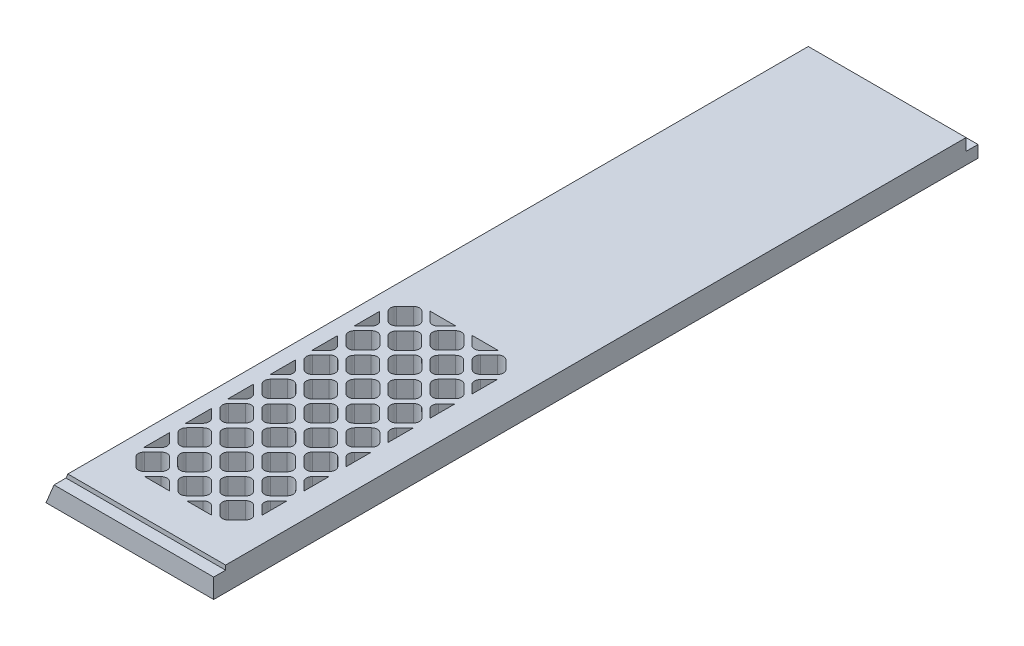
from build123d import *

# Parameters (mm, degrees)
BOSS_EXTRUDE1_DEPTH = 406.4
SKETCH2_W           = 89.154
SKETCH2_H           = 6.35
CUT_EXTRUDE1_DEPTH  = 2.3622
CUT_EXTRUDE2_DEPTH  = 417.257955739
SKETCH4_W           = 98.256448513
SKETCH4_H           = 6.35
CUT_EXTRUDE3_DEPTH  = 6.35


with BuildPart() as part:
    # Sketch1 → Boss-Extrude1 (new body)
    with BuildSketch(Plane.XY):
        Polygon((0, 0), (5.260512242, 12.7), (89.154, 12.7), (89.154, 0), align=None)
    extrude(amount=BOSS_EXTRUDE1_DEPTH)

    # Sketch2 → Cut-Extrude1 (cut)
    with BuildSketch(Plane.XZ.offset(-12.7)):
        with Locations((44.577, 403.225)):
            Rectangle(SKETCH2_W, SKETCH2_H)
    extrude(amount=CUT_EXTRUDE1_DEPTH, mode=Mode.SUBTRACT)

    # Sketch3 → Cut-Extrude2 (cut, through all)
    with BuildSketch(Plane.XZ):
        with BuildLine():
            Line((13.244743879, 255.975205334), (13.244743879, 242.242295027))
            ThreePointArc((13.244743879, 242.242295027), (13.315448739, 242.306875127), (13.384173908, 242.37355809))
            Line((13.384173908, 242.37355809), (17.874301968, 246.863686151))
            ThreePointArc((17.874301968, 246.863686151), (18.804237938, 249.108750181), (17.874301968, 251.353814211))
            Line((17.874301968, 251.353814211), (13.384173908, 255.843942271))
            ThreePointArc((13.384173908, 255.843942271), (13.315448739, 255.910625234), (13.244743879, 255.975205334))
        make_face()
        with BuildLine():
            ThreePointArc((26.755917787, 229.001814211), (26.645338589, 228.885498635), (26.54077831, 228.763743879))
            Line((26.54077831, 228.763743879), (40.441441445, 228.763743879))
            ThreePointArc((40.441441445, 228.763743879), (40.336881166, 228.885498635), (40.226301968, 229.001814211))
            Line((40.226301968, 229.001814211), (35.736173908, 233.491942271))
            ThreePointArc((35.736173908, 233.491942271), (33.491109878, 234.421878241), (31.246045847, 233.491942271))
            Line((31.246045847, 233.491942271), (26.755917787, 229.001814211))
        make_face()
        with BuildLine():
            Line((13.244743879, 278.327205334), (13.244743879, 264.594295027))
            ThreePointArc((13.244743879, 264.594295027), (13.315448739, 264.658875127), (13.384173908, 264.72555809))
            Line((13.384173908, 264.72555809), (17.874301968, 269.215686151))
            ThreePointArc((17.874301968, 269.215686151), (18.804237938, 271.460750181), (17.874301968, 273.705814211))
            Line((17.874301968, 273.705814211), (13.384173908, 278.195942271))
            ThreePointArc((13.384173908, 278.195942271), (13.315448739, 278.262625234), (13.244743879, 278.327205334))
        make_face()
        with BuildLine():
            ThreePointArc((49.107917787, 229.001814211), (48.997338588, 228.885498635), (48.89277831, 228.763743879))
            Line((48.89277831, 228.763743879), (62.793441445, 228.763743879))
            ThreePointArc((62.793441445, 228.763743879), (62.688881166, 228.885498635), (62.578301968, 229.001814211))
            Line((62.578301968, 229.001814211), (58.088173908, 233.491942271))
            ThreePointArc((58.088173908, 233.491942271), (55.843109877, 234.421878241), (53.598045847, 233.491942271))
            Line((53.598045847, 233.491942271), (49.107917787, 229.001814211))
        make_face()
        with BuildLine():
            Line((13.244743879, 300.679205334), (13.244743879, 286.946295027))
            ThreePointArc((13.244743879, 286.946295027), (13.315448739, 287.010875127), (13.384173908, 287.07755809))
            Line((13.384173908, 287.07755809), (17.874301968, 291.56768615))
            ThreePointArc((17.874301968, 291.56768615), (18.804237938, 293.812750181), (17.874301968, 296.057814211))
            Line((17.874301968, 296.057814211), (13.384173908, 300.547942271))
            ThreePointArc((13.384173908, 300.547942271), (13.315448739, 300.614625234), (13.244743879, 300.679205334))
        make_face()
        with BuildLine():
            Line((13.244743879, 323.031205334), (13.244743879, 309.298295027))
            ThreePointArc((13.244743879, 309.298295027), (13.315448739, 309.362875127), (13.384173908, 309.42955809))
            Line((13.384173908, 309.42955809), (17.874301968, 313.91968615))
            ThreePointArc((17.874301968, 313.91968615), (18.804237938, 316.16475018), (17.874301968, 318.409814211))
            Line((17.874301968, 318.409814211), (13.384173908, 322.899942271))
            ThreePointArc((13.384173908, 322.899942271), (13.315448739, 322.966625234), (13.244743879, 323.031205334))
        make_face()
        with BuildLine():
            Line((71.459917787, 246.86368615), (75.909256121, 242.414347816))
            Line((75.909256121, 242.414347816), (75.909256121, 255.803152545))
            Line((75.909256121, 255.803152545), (71.459917787, 251.353814211))
            ThreePointArc((71.459917787, 251.353814211), (70.529981817, 249.108750181), (71.459917787, 246.86368615))
        make_face()
        with BuildLine():
            Line((13.244743879, 345.383205334), (13.244743879, 331.650295027))
            ThreePointArc((13.244743879, 331.650295027), (13.315448739, 331.714875127), (13.384173908, 331.78155809))
            Line((13.384173908, 331.78155809), (17.874301968, 336.27168615))
            ThreePointArc((17.874301968, 336.27168615), (18.804237938, 338.51675018), (17.874301968, 340.761814211))
            Line((17.874301968, 340.761814211), (13.384173908, 345.251942271))
            ThreePointArc((13.384173908, 345.251942271), (13.315448739, 345.318625234), (13.244743879, 345.383205334))
        make_face()
        with BuildLine():
            Line((71.459917786, 269.21568615), (75.909256121, 264.766347816))
            Line((75.909256121, 264.766347816), (75.909256121, 278.155152546))
            Line((75.909256121, 278.155152546), (71.459917786, 273.705814211))
            ThreePointArc((71.459917786, 273.705814211), (70.529981817, 271.460750181), (71.459917786, 269.21568615))
        make_face()
        with BuildLine():
            Line((13.244743879, 367.735205334), (13.244743879, 354.002295027))
            ThreePointArc((13.244743879, 354.002295027), (13.315448739, 354.066875126), (13.384173908, 354.13355809))
            Line((13.384173908, 354.13355809), (17.874301968, 358.62368615))
            ThreePointArc((17.874301968, 358.62368615), (18.804237938, 360.86875018), (17.874301968, 363.113814211))
            Line((17.874301968, 363.113814211), (13.384173908, 367.603942271))
            ThreePointArc((13.384173908, 367.603942271), (13.315448739, 367.670625234), (13.244743879, 367.735205334))
        make_face()
        with BuildLine():
            Line((71.459917786, 291.56768615), (75.909256121, 287.118347816))
            Line((75.909256121, 287.118347816), (75.909256121, 300.507152545))
            Line((75.909256121, 300.507152545), (71.459917786, 296.057814211))
            ThreePointArc((71.459917786, 296.057814211), (70.529981817, 293.812750181), (71.459917786, 291.56768615))
        make_face()
        with BuildLine():
            Line((71.459917786, 313.91968615), (75.909256121, 309.470347816))
            Line((75.909256121, 309.470347816), (75.909256121, 322.859152545))
            Line((75.909256121, 322.859152545), (71.459917786, 318.409814211))
            ThreePointArc((71.459917786, 318.409814211), (70.529981817, 316.164750181), (71.459917786, 313.91968615))
        make_face()
        with BuildLine():
            Line((40.086871939, 380.836256121), (26.895347816, 380.836256121))
            Line((26.895347816, 380.836256121), (31.246045847, 376.485558089))
            ThreePointArc((31.246045847, 376.485558089), (33.491109877, 375.55562212), (35.736173908, 376.485558089))
            Line((35.736173908, 376.485558089), (40.086871939, 380.836256121))
        make_face()
        with BuildLine():
            Line((71.459917787, 336.27168615), (75.909256121, 331.822347816))
            Line((75.909256121, 331.822347816), (75.909256121, 345.211152545))
            Line((75.909256121, 345.211152545), (71.459917787, 340.761814211))
            ThreePointArc((71.459917787, 340.761814211), (70.529981817, 338.51675018), (71.459917787, 336.27168615))
        make_face()
        with BuildLine():
            Line((62.438871939, 380.836256121), (49.247347815, 380.836256121))
            Line((49.247347815, 380.836256121), (53.598045847, 376.485558089))
            ThreePointArc((53.598045847, 376.485558089), (55.843109877, 375.55562212), (58.088173908, 376.485558089))
            Line((58.088173908, 376.485558089), (62.438871939, 380.836256121))
        make_face()
        with BuildLine():
            Line((71.459917787, 358.62368615), (75.909256121, 354.174347816))
            Line((75.909256121, 354.174347816), (75.909256121, 367.563152545))
            Line((75.909256121, 367.563152545), (71.459917787, 363.113814211))
            ThreePointArc((71.459917787, 363.113814211), (70.529981817, 360.86875018), (71.459917787, 358.62368615))
        make_face()
        with BuildLine():
            Line((53.598045847, 255.843942272), (49.107917787, 251.353814211))
            ThreePointArc((49.107917787, 251.353814211), (48.177981817, 249.108750181), (49.107917787, 246.863686151))
            Line((49.107917787, 246.863686151), (53.598045847, 242.37355809))
            ThreePointArc((53.598045847, 242.37355809), (55.843109877, 241.44362212), (58.088173908, 242.37355809))
            Line((58.088173908, 242.37355809), (62.578301968, 246.863686151))
            ThreePointArc((62.578301968, 246.863686151), (63.508237938, 249.108750181), (62.578301968, 251.353814211))
            Line((62.578301968, 251.353814211), (58.088173908, 255.843942272))
            ThreePointArc((58.088173908, 255.843942272), (55.843109877, 256.773878241), (53.598045847, 255.843942272))
        make_face()
        with BuildLine():
            Line((31.246045847, 255.843942272), (26.755917787, 251.353814211))
            ThreePointArc((26.755917787, 251.353814211), (25.825981817, 249.108750181), (26.755917787, 246.863686151))
            Line((26.755917787, 246.863686151), (31.246045847, 242.37355809))
            ThreePointArc((31.246045847, 242.37355809), (33.491109877, 241.44362212), (35.736173908, 242.37355809))
            Line((35.736173908, 242.37355809), (40.226301968, 246.863686151))
            ThreePointArc((40.226301968, 246.863686151), (41.156237938, 249.108750181), (40.226301968, 251.353814211))
            Line((40.226301968, 251.353814211), (35.736173908, 255.843942272))
            ThreePointArc((35.736173908, 255.843942272), (33.491109877, 256.773878241), (31.246045847, 255.843942272))
        make_face()
        with BuildLine():
            Line((53.598045847, 278.195942272), (49.107917787, 273.705814211))
            ThreePointArc((49.107917787, 273.705814211), (48.177981817, 271.460750181), (49.107917787, 269.215686151))
            Line((49.107917787, 269.215686151), (53.598045847, 264.72555809))
            ThreePointArc((53.598045847, 264.72555809), (55.843109877, 263.79562212), (58.088173908, 264.72555809))
            Line((58.088173908, 264.72555809), (62.578301968, 269.215686151))
            ThreePointArc((62.578301968, 269.215686151), (63.508237938, 271.460750181), (62.578301968, 273.705814211))
            Line((62.578301968, 273.705814211), (58.088173908, 278.195942272))
            ThreePointArc((58.088173908, 278.195942272), (55.843109877, 279.125878241), (53.598045847, 278.195942272))
        make_face()
        with BuildLine():
            Line((31.246045847, 278.195942272), (26.755917787, 273.705814211))
            ThreePointArc((26.755917787, 273.705814211), (25.825981817, 271.460750181), (26.755917787, 269.215686151))
            Line((26.755917787, 269.215686151), (31.246045847, 264.72555809))
            ThreePointArc((31.246045847, 264.72555809), (33.491109877, 263.79562212), (35.736173908, 264.72555809))
            Line((35.736173908, 264.72555809), (40.226301968, 269.215686151))
            ThreePointArc((40.226301968, 269.215686151), (41.156237938, 271.460750181), (40.226301968, 273.705814211))
            Line((40.226301968, 273.705814211), (35.736173908, 278.195942272))
            ThreePointArc((35.736173908, 278.195942272), (33.491109877, 279.125878241), (31.246045847, 278.195942272))
        make_face()
        with BuildLine():
            Line((53.598045847, 300.547942271), (49.107917787, 296.057814211))
            ThreePointArc((49.107917787, 296.057814211), (48.177981817, 293.812750181), (49.107917787, 291.56768615))
            Line((49.107917787, 291.56768615), (53.598045847, 287.07755809))
            ThreePointArc((53.598045847, 287.07755809), (55.843109877, 286.14762212), (58.088173908, 287.07755809))
            Line((58.088173908, 287.07755809), (62.578301968, 291.56768615))
            ThreePointArc((62.578301968, 291.56768615), (63.508237938, 293.812750181), (62.578301968, 296.057814211))
            Line((62.578301968, 296.057814211), (58.088173908, 300.547942271))
            ThreePointArc((58.088173908, 300.547942271), (55.843109877, 301.477878241), (53.598045847, 300.547942271))
        make_face()
        with BuildLine():
            Line((31.246045847, 300.547942271), (26.755917787, 296.057814211))
            ThreePointArc((26.755917787, 296.057814211), (25.825981817, 293.812750181), (26.755917787, 291.56768615))
            Line((26.755917787, 291.56768615), (31.246045847, 287.07755809))
            ThreePointArc((31.246045847, 287.07755809), (33.491109877, 286.14762212), (35.736173908, 287.07755809))
            Line((35.736173908, 287.07755809), (40.226301968, 291.56768615))
            ThreePointArc((40.226301968, 291.56768615), (41.156237938, 293.812750181), (40.226301968, 296.057814211))
            Line((40.226301968, 296.057814211), (35.736173908, 300.547942271))
            ThreePointArc((35.736173908, 300.547942271), (33.491109877, 301.477878241), (31.246045847, 300.547942271))
        make_face()
        with BuildLine():
            Line((53.598045847, 322.899942271), (49.107917787, 318.409814211))
            ThreePointArc((49.107917787, 318.409814211), (48.177981817, 316.164750181), (49.107917787, 313.91968615))
            Line((49.107917787, 313.91968615), (53.598045847, 309.42955809))
            ThreePointArc((53.598045847, 309.42955809), (55.843109877, 308.49962212), (58.088173908, 309.42955809))
            Line((58.088173908, 309.42955809), (62.578301968, 313.91968615))
            ThreePointArc((62.578301968, 313.91968615), (63.508237938, 316.164750181), (62.578301968, 318.409814211))
            Line((62.578301968, 318.409814211), (58.088173908, 322.899942271))
            ThreePointArc((58.088173908, 322.899942271), (55.843109877, 323.829878241), (53.598045847, 322.899942271))
        make_face()
        with BuildLine():
            Line((31.246045847, 322.899942271), (26.755917787, 318.409814211))
            ThreePointArc((26.755917787, 318.409814211), (25.825981817, 316.164750181), (26.755917787, 313.91968615))
            Line((26.755917787, 313.91968615), (31.246045847, 309.42955809))
            ThreePointArc((31.246045847, 309.42955809), (33.491109877, 308.49962212), (35.736173908, 309.42955809))
            Line((35.736173908, 309.42955809), (40.226301968, 313.91968615))
            ThreePointArc((40.226301968, 313.91968615), (41.156237938, 316.164750181), (40.226301968, 318.409814211))
            Line((40.226301968, 318.409814211), (35.736173908, 322.899942271))
            ThreePointArc((35.736173908, 322.899942271), (33.491109877, 323.829878241), (31.246045847, 322.899942271))
        make_face()
        with BuildLine():
            Line((53.598045847, 345.251942271), (49.107917787, 340.761814211))
            ThreePointArc((49.107917787, 340.761814211), (48.177981817, 338.51675018), (49.107917787, 336.27168615))
            Line((49.107917787, 336.27168615), (53.598045847, 331.78155809))
            ThreePointArc((53.598045847, 331.78155809), (55.843109877, 330.85162212), (58.088173908, 331.78155809))
            Line((58.088173908, 331.78155809), (62.578301968, 336.27168615))
            ThreePointArc((62.578301968, 336.27168615), (63.508237938, 338.51675018), (62.578301968, 340.761814211))
            Line((62.578301968, 340.761814211), (58.088173908, 345.251942271))
            ThreePointArc((58.088173908, 345.251942271), (55.843109877, 346.181878241), (53.598045847, 345.251942271))
        make_face()
        with BuildLine():
            Line((31.246045847, 345.251942271), (26.755917787, 340.761814211))
            ThreePointArc((26.755917787, 340.761814211), (25.825981817, 338.51675018), (26.755917787, 336.27168615))
            Line((26.755917787, 336.27168615), (31.246045847, 331.78155809))
            ThreePointArc((31.246045847, 331.78155809), (33.491109877, 330.85162212), (35.736173908, 331.78155809))
            Line((35.736173908, 331.78155809), (40.226301968, 336.27168615))
            ThreePointArc((40.226301968, 336.27168615), (41.156237938, 338.51675018), (40.226301968, 340.761814211))
            Line((40.226301968, 340.761814211), (35.736173908, 345.251942271))
            ThreePointArc((35.736173908, 345.251942271), (33.491109877, 346.181878241), (31.246045847, 345.251942271))
        make_face()
        with BuildLine():
            Line((53.598045847, 367.603942271), (49.107917787, 363.113814211))
            ThreePointArc((49.107917787, 363.113814211), (48.177981817, 360.86875018), (49.107917787, 358.62368615))
            Line((49.107917787, 358.62368615), (53.598045847, 354.13355809))
            ThreePointArc((53.598045847, 354.13355809), (55.843109877, 353.20362212), (58.088173908, 354.13355809))
            Line((58.088173908, 354.13355809), (62.578301968, 358.62368615))
            ThreePointArc((62.578301968, 358.62368615), (63.508237938, 360.86875018), (62.578301968, 363.113814211))
            Line((62.578301968, 363.113814211), (58.088173908, 367.603942271))
            ThreePointArc((58.088173908, 367.603942271), (55.843109877, 368.533878241), (53.598045847, 367.603942271))
        make_face()
        with BuildLine():
            Line((31.246045847, 367.603942271), (26.755917787, 363.113814211))
            ThreePointArc((26.755917787, 363.113814211), (25.825981817, 360.86875018), (26.755917787, 358.62368615))
            Line((26.755917787, 358.62368615), (31.246045847, 354.13355809))
            ThreePointArc((31.246045847, 354.13355809), (33.491109877, 353.20362212), (35.736173908, 354.13355809))
            Line((35.736173908, 354.13355809), (40.226301968, 358.62368615))
            ThreePointArc((40.226301968, 358.62368615), (41.156237938, 360.86875018), (40.226301968, 363.113814211))
            Line((40.226301968, 363.113814211), (35.736173908, 367.603942271))
            ThreePointArc((35.736173908, 367.603942271), (33.491109877, 368.533878241), (31.246045847, 367.603942271))
        make_face()
        with BuildLine():
            Line((69.17406403, 231.008807909), (73.664192091, 235.49893597))
            ThreePointArc((73.664192091, 235.49893597), (74.594128061, 237.744), (73.664192091, 239.98906403))
            Line((73.664192091, 239.98906403), (69.17406403, 244.479192091))
            ThreePointArc((69.17406403, 244.479192091), (66.929, 245.409128061), (64.68393597, 244.479192091))
            Line((64.68393597, 244.479192091), (60.193807909, 239.98906403))
            ThreePointArc((60.193807909, 239.98906403), (59.263871939, 237.744), (60.193807909, 235.49893597))
            Line((60.193807909, 235.49893597), (64.68393597, 231.008807909))
            ThreePointArc((64.68393597, 231.008807909), (66.929, 230.078871939), (69.17406403, 231.008807909))
        make_face()
        with BuildLine():
            Line((46.82206403, 231.008807909), (51.312192091, 235.49893597))
            ThreePointArc((51.312192091, 235.49893597), (52.242128061, 237.744), (51.312192091, 239.98906403))
            Line((51.312192091, 239.98906403), (46.82206403, 244.479192091))
            ThreePointArc((46.82206403, 244.479192091), (44.577, 245.409128061), (42.33193597, 244.479192091))
            Line((42.33193597, 244.479192091), (37.841807909, 239.98906403))
            ThreePointArc((37.841807909, 239.98906403), (36.911871939, 237.744), (37.841807909, 235.49893597))
            Line((37.841807909, 235.49893597), (42.33193597, 231.008807909))
            ThreePointArc((42.33193597, 231.008807909), (44.577, 230.078871939), (46.82206403, 231.008807909))
        make_face()
        with BuildLine():
            Line((24.47006403, 231.008807909), (28.960192091, 235.49893597))
            ThreePointArc((28.960192091, 235.49893597), (29.890128061, 237.744), (28.960192091, 239.98906403))
            Line((28.960192091, 239.98906403), (24.47006403, 244.479192091))
            ThreePointArc((24.47006403, 244.479192091), (22.225, 245.409128061), (19.97993597, 244.479192091))
            Line((19.97993597, 244.479192091), (15.489807909, 239.98906403))
            ThreePointArc((15.489807909, 239.98906403), (14.559871939, 237.744), (15.489807909, 235.49893597))
            Line((15.489807909, 235.49893597), (19.97993597, 231.008807909))
            ThreePointArc((19.97993597, 231.008807909), (22.225, 230.078871939), (24.47006403, 231.008807909))
        make_face()
        with BuildLine():
            Line((69.17406403, 253.360807909), (73.664192091, 257.85093597))
            ThreePointArc((73.664192091, 257.85093597), (74.594128061, 260.096), (73.664192091, 262.34106403))
            Line((73.664192091, 262.34106403), (69.17406403, 266.831192091))
            ThreePointArc((69.17406403, 266.831192091), (66.929, 267.761128061), (64.68393597, 266.831192091))
            Line((64.68393597, 266.831192091), (60.193807909, 262.34106403))
            ThreePointArc((60.193807909, 262.34106403), (59.263871939, 260.096), (60.193807909, 257.85093597))
            Line((60.193807909, 257.85093597), (64.68393597, 253.360807909))
            ThreePointArc((64.68393597, 253.360807909), (66.929, 252.430871939), (69.17406403, 253.360807909))
        make_face()
        with BuildLine():
            Line((46.82206403, 253.360807909), (51.312192091, 257.85093597))
            ThreePointArc((51.312192091, 257.85093597), (52.242128061, 260.096), (51.312192091, 262.34106403))
            Line((51.312192091, 262.34106403), (46.82206403, 266.831192091))
            ThreePointArc((46.82206403, 266.831192091), (44.577, 267.761128061), (42.33193597, 266.831192091))
            Line((42.33193597, 266.831192091), (37.841807909, 262.34106403))
            ThreePointArc((37.841807909, 262.34106403), (36.911871939, 260.096), (37.841807909, 257.85093597))
            Line((37.841807909, 257.85093597), (42.33193597, 253.360807909))
            ThreePointArc((42.33193597, 253.360807909), (44.577, 252.430871939), (46.82206403, 253.360807909))
        make_face()
        with BuildLine():
            Line((24.47006403, 253.360807909), (28.960192091, 257.85093597))
            ThreePointArc((28.960192091, 257.85093597), (29.890128061, 260.096), (28.960192091, 262.34106403))
            Line((28.960192091, 262.34106403), (24.47006403, 266.831192091))
            ThreePointArc((24.47006403, 266.831192091), (22.225, 267.761128061), (19.97993597, 266.831192091))
            Line((19.97993597, 266.831192091), (15.489807909, 262.34106403))
            ThreePointArc((15.489807909, 262.34106403), (14.559871939, 260.096), (15.489807909, 257.85093597))
            Line((15.489807909, 257.85093597), (19.97993597, 253.360807909))
            ThreePointArc((19.97993597, 253.360807909), (22.225, 252.430871939), (24.47006403, 253.360807909))
        make_face()
        with BuildLine():
            Line((69.17406403, 275.712807909), (73.664192091, 280.20293597))
            ThreePointArc((73.664192091, 280.20293597), (74.594128061, 282.448), (73.664192091, 284.69306403))
            Line((73.664192091, 284.69306403), (69.17406403, 289.183192091))
            ThreePointArc((69.17406403, 289.183192091), (66.929, 290.113128061), (64.68393597, 289.183192091))
            Line((64.68393597, 289.183192091), (60.193807909, 284.69306403))
            ThreePointArc((60.193807909, 284.69306403), (59.263871939, 282.448), (60.193807909, 280.20293597))
            Line((60.193807909, 280.20293597), (64.68393597, 275.712807909))
            ThreePointArc((64.68393597, 275.712807909), (66.929, 274.782871939), (69.17406403, 275.712807909))
        make_face()
        with BuildLine():
            Line((46.82206403, 275.712807909), (51.312192091, 280.20293597))
            ThreePointArc((51.312192091, 280.20293597), (52.242128061, 282.448), (51.312192091, 284.69306403))
            Line((51.312192091, 284.69306403), (46.82206403, 289.183192091))
            ThreePointArc((46.82206403, 289.183192091), (44.577, 290.113128061), (42.33193597, 289.183192091))
            Line((42.33193597, 289.183192091), (37.841807909, 284.69306403))
            ThreePointArc((37.841807909, 284.69306403), (36.911871939, 282.448), (37.841807909, 280.20293597))
            Line((37.841807909, 280.20293597), (42.33193597, 275.712807909))
            ThreePointArc((42.33193597, 275.712807909), (44.577, 274.782871939), (46.82206403, 275.712807909))
        make_face()
        with BuildLine():
            Line((24.47006403, 275.712807909), (28.960192091, 280.20293597))
            ThreePointArc((28.960192091, 280.20293597), (29.890128061, 282.448), (28.960192091, 284.69306403))
            Line((28.960192091, 284.69306403), (24.47006403, 289.183192091))
            ThreePointArc((24.47006403, 289.183192091), (22.225, 290.113128061), (19.97993597, 289.183192091))
            Line((19.97993597, 289.183192091), (15.489807909, 284.69306403))
            ThreePointArc((15.489807909, 284.69306403), (14.559871939, 282.448), (15.489807909, 280.20293597))
            Line((15.489807909, 280.20293597), (19.97993597, 275.712807909))
            ThreePointArc((19.97993597, 275.712807909), (22.225, 274.782871939), (24.47006403, 275.712807909))
        make_face()
        with BuildLine():
            Line((69.17406403, 298.064807909), (73.664192091, 302.55493597))
            ThreePointArc((73.664192091, 302.55493597), (74.594128061, 304.8), (73.664192091, 307.04506403))
            Line((73.664192091, 307.04506403), (69.17406403, 311.535192091))
            ThreePointArc((69.17406403, 311.535192091), (66.929, 312.465128061), (64.68393597, 311.535192091))
            Line((64.68393597, 311.535192091), (60.193807909, 307.04506403))
            ThreePointArc((60.193807909, 307.04506403), (59.263871939, 304.8), (60.193807909, 302.55493597))
            Line((60.193807909, 302.55493597), (64.68393597, 298.064807909))
            ThreePointArc((64.68393597, 298.064807909), (66.929, 297.134871939), (69.17406403, 298.064807909))
        make_face()
        with BuildLine():
            Line((46.82206403, 298.064807909), (51.312192091, 302.55493597))
            ThreePointArc((51.312192091, 302.55493597), (52.242128061, 304.8), (51.312192091, 307.04506403))
            Line((51.312192091, 307.04506403), (46.82206403, 311.535192091))
            ThreePointArc((46.82206403, 311.535192091), (44.577, 312.465128061), (42.33193597, 311.535192091))
            Line((42.33193597, 311.535192091), (37.841807909, 307.04506403))
            ThreePointArc((37.841807909, 307.04506403), (36.911871939, 304.8), (37.841807909, 302.55493597))
            Line((37.841807909, 302.55493597), (42.33193597, 298.064807909))
            ThreePointArc((42.33193597, 298.064807909), (44.577, 297.134871939), (46.82206403, 298.064807909))
        make_face()
        with BuildLine():
            Line((24.47006403, 298.064807909), (28.960192091, 302.55493597))
            ThreePointArc((28.960192091, 302.55493597), (29.890128061, 304.8), (28.960192091, 307.04506403))
            Line((28.960192091, 307.04506403), (24.47006403, 311.535192091))
            ThreePointArc((24.47006403, 311.535192091), (22.225, 312.465128061), (19.97993597, 311.535192091))
            Line((19.97993597, 311.535192091), (15.489807909, 307.04506403))
            ThreePointArc((15.489807909, 307.04506403), (14.559871939, 304.8), (15.489807909, 302.55493597))
            Line((15.489807909, 302.55493597), (19.97993597, 298.064807909))
            ThreePointArc((19.97993597, 298.064807909), (22.225, 297.134871939), (24.47006403, 298.064807909))
        make_face()
        with BuildLine():
            Line((69.17406403, 320.416807909), (73.664192091, 324.90693597))
            ThreePointArc((73.664192091, 324.90693597), (74.594128061, 327.152), (73.664192091, 329.39706403))
            Line((73.664192091, 329.39706403), (69.17406403, 333.887192091))
            ThreePointArc((69.17406403, 333.887192091), (66.929, 334.817128061), (64.68393597, 333.887192091))
            Line((64.68393597, 333.887192091), (60.193807909, 329.39706403))
            ThreePointArc((60.193807909, 329.39706403), (59.263871939, 327.152), (60.193807909, 324.90693597))
            Line((60.193807909, 324.90693597), (64.68393597, 320.416807909))
            ThreePointArc((64.68393597, 320.416807909), (66.929, 319.486871939), (69.17406403, 320.416807909))
        make_face()
        with BuildLine():
            Line((46.82206403, 320.416807909), (51.312192091, 324.90693597))
            ThreePointArc((51.312192091, 324.90693597), (52.242128061, 327.152), (51.312192091, 329.39706403))
            Line((51.312192091, 329.39706403), (46.82206403, 333.887192091))
            ThreePointArc((46.82206403, 333.887192091), (44.577, 334.817128061), (42.33193597, 333.887192091))
            Line((42.33193597, 333.887192091), (37.841807909, 329.39706403))
            ThreePointArc((37.841807909, 329.39706403), (36.911871939, 327.152), (37.841807909, 324.90693597))
            Line((37.841807909, 324.90693597), (42.33193597, 320.416807909))
            ThreePointArc((42.33193597, 320.416807909), (44.577, 319.486871939), (46.82206403, 320.416807909))
        make_face()
        with BuildLine():
            Line((24.47006403, 320.416807909), (28.960192091, 324.90693597))
            ThreePointArc((28.960192091, 324.90693597), (29.890128061, 327.152), (28.960192091, 329.39706403))
            Line((28.960192091, 329.39706403), (24.47006403, 333.887192091))
            ThreePointArc((24.47006403, 333.887192091), (22.225, 334.817128061), (19.97993597, 333.887192091))
            Line((19.97993597, 333.887192091), (15.489807909, 329.39706403))
            ThreePointArc((15.489807909, 329.39706403), (14.559871939, 327.152), (15.489807909, 324.90693597))
            Line((15.489807909, 324.90693597), (19.97993597, 320.416807909))
            ThreePointArc((19.97993597, 320.416807909), (22.225, 319.486871939), (24.47006403, 320.416807909))
        make_face()
        with BuildLine():
            Line((69.17406403, 342.768807909), (73.664192091, 347.25893597))
            ThreePointArc((73.664192091, 347.25893597), (74.594128061, 349.504), (73.664192091, 351.74906403))
            Line((73.664192091, 351.74906403), (69.17406403, 356.239192091))
            ThreePointArc((69.17406403, 356.239192091), (66.929, 357.169128061), (64.68393597, 356.239192091))
            Line((64.68393597, 356.239192091), (60.193807909, 351.74906403))
            ThreePointArc((60.193807909, 351.74906403), (59.263871939, 349.504), (60.193807909, 347.25893597))
            Line((60.193807909, 347.25893597), (64.68393597, 342.768807909))
            ThreePointArc((64.68393597, 342.768807909), (66.929, 341.838871939), (69.17406403, 342.768807909))
        make_face()
        with BuildLine():
            Line((46.82206403, 342.768807909), (51.312192091, 347.25893597))
            ThreePointArc((51.312192091, 347.25893597), (52.242128061, 349.504), (51.312192091, 351.74906403))
            Line((51.312192091, 351.74906403), (46.82206403, 356.239192091))
            ThreePointArc((46.82206403, 356.239192091), (44.577, 357.169128061), (42.33193597, 356.239192091))
            Line((42.33193597, 356.239192091), (37.841807909, 351.74906403))
            ThreePointArc((37.841807909, 351.74906403), (36.911871939, 349.504), (37.841807909, 347.25893597))
            Line((37.841807909, 347.25893597), (42.33193597, 342.768807909))
            ThreePointArc((42.33193597, 342.768807909), (44.577, 341.838871939), (46.82206403, 342.768807909))
        make_face()
        with BuildLine():
            Line((24.47006403, 342.768807909), (28.960192091, 347.25893597))
            ThreePointArc((28.960192091, 347.25893597), (29.890128061, 349.504), (28.960192091, 351.74906403))
            Line((28.960192091, 351.74906403), (24.47006403, 356.239192091))
            ThreePointArc((24.47006403, 356.239192091), (22.225, 357.169128061), (19.97993597, 356.239192091))
            Line((19.97993597, 356.239192091), (15.489807909, 351.74906403))
            ThreePointArc((15.489807909, 351.74906403), (14.559871939, 349.504), (15.489807909, 347.25893597))
            Line((15.489807909, 347.25893597), (19.97993597, 342.768807909))
            ThreePointArc((19.97993597, 342.768807909), (22.225, 341.838871939), (24.47006403, 342.768807909))
        make_face()
        with BuildLine():
            Line((69.17406403, 365.120807909), (73.664192091, 369.61093597))
            ThreePointArc((73.664192091, 369.61093597), (74.594128061, 371.856), (73.664192091, 374.10106403))
            Line((73.664192091, 374.10106403), (69.17406403, 378.591192091))
            ThreePointArc((69.17406403, 378.591192091), (66.929, 379.521128061), (64.68393597, 378.591192091))
            Line((64.68393597, 378.591192091), (60.193807909, 374.10106403))
            ThreePointArc((60.193807909, 374.10106403), (59.263871939, 371.856), (60.193807909, 369.61093597))
            Line((60.193807909, 369.61093597), (64.68393597, 365.120807909))
            ThreePointArc((64.68393597, 365.120807909), (66.929, 364.190871939), (69.17406403, 365.120807909))
        make_face()
        with BuildLine():
            Line((46.82206403, 365.120807909), (51.312192091, 369.61093597))
            ThreePointArc((51.312192091, 369.61093597), (52.242128061, 371.856), (51.312192091, 374.10106403))
            Line((51.312192091, 374.10106403), (46.82206403, 378.591192091))
            ThreePointArc((46.82206403, 378.591192091), (44.577, 379.521128061), (42.33193597, 378.591192091))
            Line((42.33193597, 378.591192091), (37.841807909, 374.10106403))
            ThreePointArc((37.841807909, 374.10106403), (36.911871939, 371.856), (37.841807909, 369.61093597))
            Line((37.841807909, 369.61093597), (42.33193597, 365.120807909))
            ThreePointArc((42.33193597, 365.120807909), (44.577, 364.190871939), (46.82206403, 365.120807909))
        make_face()
        with BuildLine():
            Line((15.489807909, 369.61093597), (19.97993597, 365.120807909))
            ThreePointArc((19.97993597, 365.120807909), (22.225, 364.190871939), (24.47006403, 365.120807909))
            Line((24.47006403, 365.120807909), (28.960192091, 369.61093597))
            ThreePointArc((28.960192091, 369.61093597), (29.890128061, 371.856), (28.960192091, 374.10106403))
            Line((28.960192091, 374.10106403), (24.47006403, 378.591192091))
            ThreePointArc((24.47006403, 378.591192091), (22.225, 379.521128061), (19.97993597, 378.591192091))
            Line((19.97993597, 378.591192091), (15.489807909, 374.10106403))
            ThreePointArc((15.489807909, 374.10106403), (14.559871939, 371.856), (15.489807909, 369.61093597))
        make_face()
    extrude(amount=-CUT_EXTRUDE2_DEPTH, mode=Mode.SUBTRACT)

    # Sketch4 → Cut-Extrude3 (cut)
    with BuildSketch(Plane(origin=(0, 12.7, 0), x_dir=(1, 0, 0), z_dir=(0, 1, 0))):
        with Locations((40.025775744, -3.175)):
            Rectangle(SKETCH4_W, SKETCH4_H)
    extrude(amount=-CUT_EXTRUDE3_DEPTH, mode=Mode.SUBTRACT)


solid = part.part
